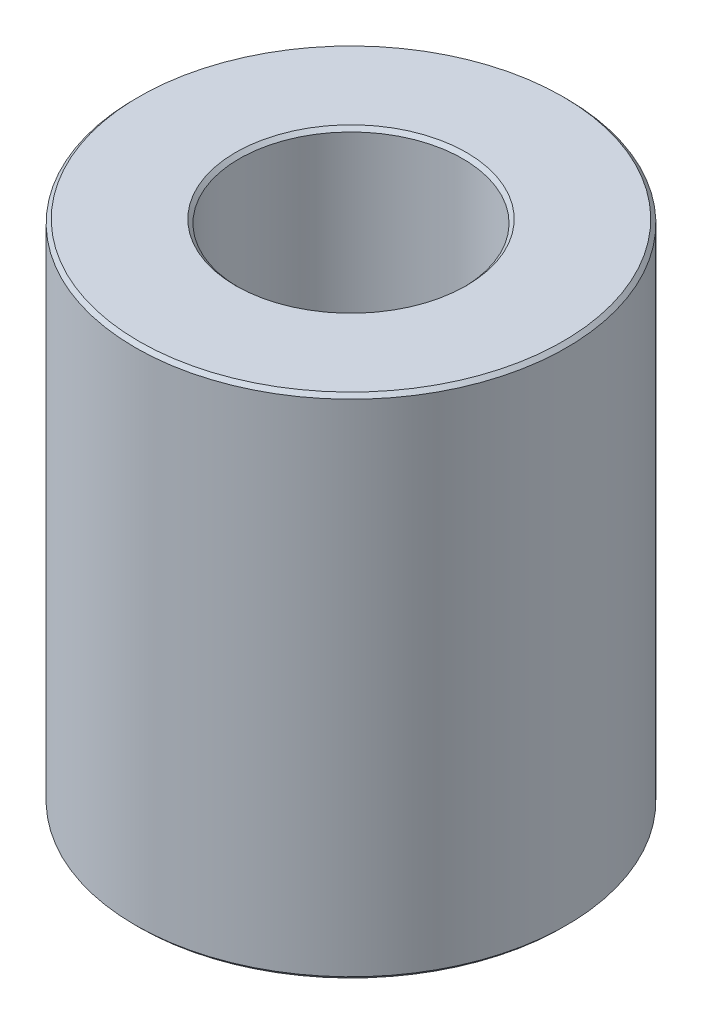
from build123d import *

# Parameters (mm, degrees)
SKETCH1_R           = 42.5
BOSS_EXTRUDE1_DEPTH = 100.032803976
SKETCH2_R           = 22.037830927
CUT_EXTRUDE1_DEPTH  = 117.700736379
CHAMFER1_SIZE       = 0.716584076


with BuildPart() as part:
    # Sketch1 → Boss-Extrude1 (new body)
    with BuildSketch(Plane(origin=(0, 0, 0), x_dir=(1, 0, 0), z_dir=(0, 1, 0))):
        Circle(SKETCH1_R)
    extrude(amount=BOSS_EXTRUDE1_DEPTH)

    # Sketch2 → Cut-Extrude1 (cut, through all)
    with BuildSketch(Plane(origin=(0, 0, 0), x_dir=(1, 0, 0), z_dir=(0, 1, 0))):
        Circle(SKETCH2_R)
    extrude(amount=CUT_EXTRUDE1_DEPTH, mode=Mode.SUBTRACT)

    # Chamfer1
    chamfer1_edges = [part.edges().sort_by_distance(p)[0] for p in [
        (-22.037830927, 100.032803976, 0),
        (-22.037830927, 0, 0),
        (-42.5, 0, 0),
        (-42.5, 100.032803976, 0),
    ]]
    chamfer(chamfer1_edges, length=CHAMFER1_SIZE)


solid = part.part
